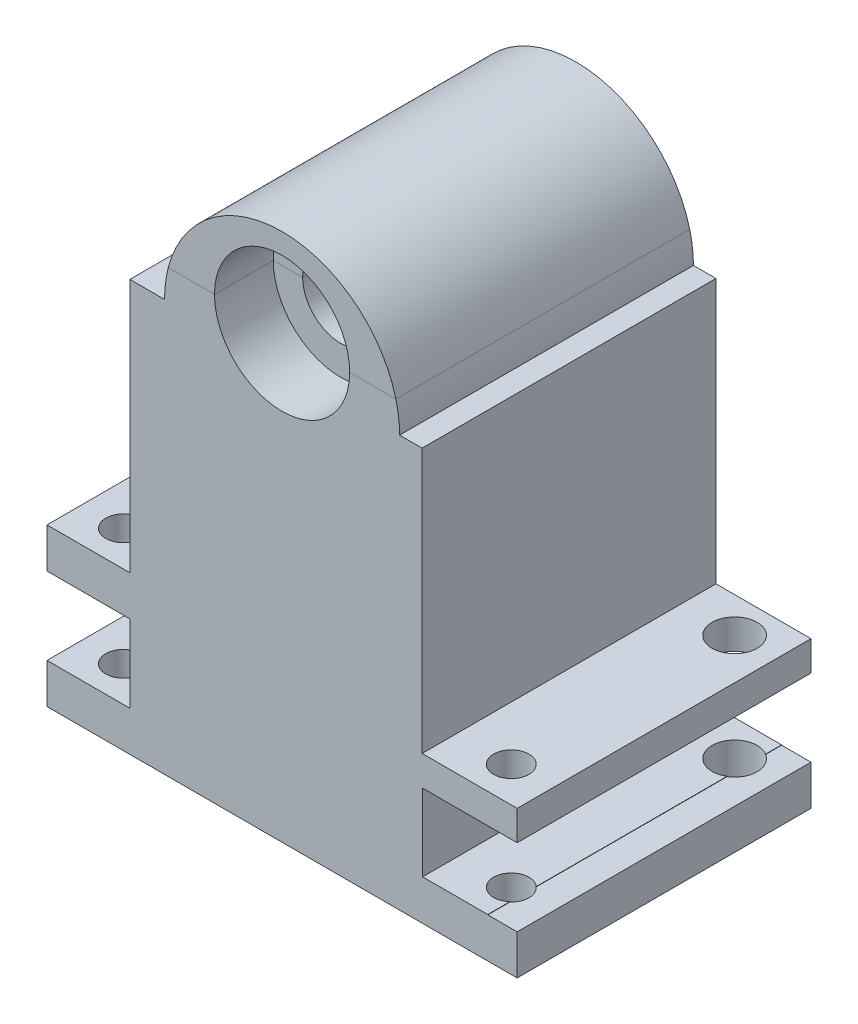
from build123d import *

# Parameters (mm, degrees)
BOSS_EXTRU_1_DEPTH      = 500
ESQUISSE2_W             = 700
ESQUISSE2_H             = 500
BOSS_EXTRU_2_DEPTH      = 250
ESQUISSE3_R             = 65
ENL_V_MAT_EXTRU_1_DEPTH = 500
ESQUISSE4_W             = 91.072749712
ESQUISSE4_H             = 131.669737078
ENL_V_MAT_EXTRU_2_DEPTH = 500
ESQUISSE5_W             = 110.887682399
ESQUISSE5_H             = 130.745719327
ENL_V_MAT_EXTRU_3_DEPTH = 500
ENL_V_START             = -100
ESQUISSE6_R             = 115
ESQUISSE6_R_2           = 65
ENL_V_MAT_EXTRU_4_DEPTH = 100
ESQUISSE7_R             = 115
ESQUISSE7_R_2           = 65
ENL_V_MAT_EXTRU_5_DEPTH = 100
ESQUISSE9_W             = 50
ESQUISSE9_H             = 500.658692186
ESQUISSE9_H_2           = 68.053564491
ESQUISSE9_H_3           = 500.318853577
ESQUISSE9_H_4           = 68.011409345
BOSS_EXTRU_3_DEPTH      = 500
ESQUISSE10_W            = 141.072749712
ESQUISSE10_H            = 432.308853577
ESQUISSE10_W_2          = 161.717775925
ESQUISSE10_H_2          = 450
ENL_V_MAT_EXTRU_6_DEPTH = 500
ESQUISSE11_R            = 30
ENL_V_MAT_EXTRU_7_DEPTH = 310
ESQUISSE12_R            = 38.334173136
ESQUISSE12_R_2          = 30
ENL_V_MAT_EXTRU_8_DEPTH = 310


with BuildPart() as part:
    # Esquisse1 → Boss.-Extru.1 (new body)
    with BuildSketch(Plane.XY):
        with BuildLine():
            Line((0, 0), (700, 0))
            Line((700, 0), (700, 450))
            Line((700, 450), (550, 450))
            ThreePointArc((550, 450), (350, 650), (150, 450))
            Line((150, 450), (0, 450))
            Line((0, 450), (0, 0))
        make_face()
    extrude(amount=BOSS_EXTRU_1_DEPTH)

    # Esquisse2 → Boss.-Extru.2 (add)
    with BuildSketch(Plane.XZ):
        with Locations((350, 250)):
            Rectangle(ESQUISSE2_W, ESQUISSE2_H)
    extrude(amount=BOSS_EXTRU_2_DEPTH)

    # Esquisse3 → Enlèv. mat.-Extru.1 (cut)
    with BuildSketch(Plane(origin=(0, 0, 0), x_dir=(-1, 0, 0), z_dir=(0, 0, -1))):
        with Locations((-350, 500)):
            Circle(ESQUISSE3_R)
    extrude(amount=-ENL_V_MAT_EXTRU_1_DEPTH, mode=Mode.SUBTRACT)

    # Esquisse4 → Enlèv. mat.-Extru.2 (cut)
    with BuildSketch(Plane(origin=(0, 0, 0), x_dir=(-1, 0, 0), z_dir=(0, 0, -1))):
        with Locations((-45.536374856, -116.153722116)):
            Rectangle(ESQUISSE4_W, ESQUISSE4_H)
    extrude(amount=-ENL_V_MAT_EXTRU_2_DEPTH, mode=Mode.SUBTRACT)

    # Esquisse5 → Enlèv. mat.-Extru.3 (cut)
    with BuildSketch(Plane(origin=(0, 0, 0), x_dir=(-1, 0, 0), z_dir=(0, 0, -1))):
        with Locations((-644.556158801, -116.03155185)):
            Rectangle(ESQUISSE5_W, ESQUISSE5_H)
    extrude(amount=-ENL_V_MAT_EXTRU_3_DEPTH, mode=Mode.SUBTRACT)

    # Esquisse6 → Enlèv. mat.-Extru.4 (cut)
    with BuildSketch(Plane.XY.offset(500).offset(ENL_V_START)):
        with Locations((350, 500)):
            Circle(ESQUISSE6_R)
        with Locations((350, 500)):
            Circle(ESQUISSE6_R_2, mode=Mode.SUBTRACT)
    extrude(amount=ENL_V_MAT_EXTRU_4_DEPTH, mode=Mode.SUBTRACT)


with BuildPart() as body_2:
    # Fractionner2: the piece on the far side of the plane
    add(part.part)
    split(bisect_by=Plane(origin=(0, 500, 0), x_dir=(0, 0, -1), z_dir=(0, -1, 0)), keep=Keep.BOTTOM)


with BuildPart() as part_1:
    add(part.part)

    # Fractionner2
    split(bisect_by=Plane(origin=(0, 500, 0), x_dir=(0, 0, -1), z_dir=(0, -1, 0)), keep=Keep.TOP)


with BuildPart() as enl_v_mat_extru_5_tool:
    # Esquisse7 → Enlèv. mat.-Extru.5 (new body)
    with BuildSketch(Plane(origin=(0, 0, 0), x_dir=(-1, 0, 0), z_dir=(0, 0, -1))):
        with Locations((-350, 500)):
            Circle(ESQUISSE7_R)
        with Locations((-350, 500)):
            Circle(ESQUISSE7_R_2, mode=Mode.SUBTRACT)
    extrude(amount=-ENL_V_MAT_EXTRU_5_DEPTH)


with BuildPart() as part_2:
    add(part_1.part)

    # Enlèv. mat.-Extru.5: cut by enl_v_mat_extru_5_tool
    add(enl_v_mat_extru_5_tool.part, mode=Mode.SUBTRACT)

    # Esquisse9 → Boss.-Extru.3 (add)
    with BuildSketch(Plane.XY.offset(500)):
        with Locations((725, 199.670653907)):
            Rectangle(ESQUISSE9_W, ESQUISSE9_H)
        with Locations((725, -215.973217755)):
            Rectangle(ESQUISSE9_W, ESQUISSE9_H_2)
        with Locations((-25, 199.840573211)):
            Rectangle(ESQUISSE9_W, ESQUISSE9_H_3)
        with Locations((-25, -215.994295328)):
            Rectangle(ESQUISSE9_W, ESQUISSE9_H_4)
    extrude(amount=-BOSS_EXTRU_3_DEPTH)

    # Esquisse10 → Enlèv. mat.-Extru.6 (cut)
    with BuildSketch(Plane.XY.offset(500)):
        with Locations((20.536374856, 233.845573212)):
            Rectangle(ESQUISSE10_W, ESQUISSE10_H)
        with Locations((669.141112038, 225)):
            Rectangle(ESQUISSE10_W_2, ESQUISSE10_H_2)
    extrude(amount=-ENL_V_MAT_EXTRU_6_DEPTH, mode=Mode.SUBTRACT)

    # Esquisse11 → Enlèv. mat.-Extru.7 (cut)
    with BuildSketch(Plane(origin=(0, 17.691146423, 0), x_dir=(1, 0, 0), z_dir=(0, 1, 0))):
        with Locations((20, -60)):
            Circle(ESQUISSE11_R)
        with Locations((20, -440)):
            Circle(ESQUISSE11_R)
    extrude(amount=-ENL_V_MAT_EXTRU_7_DEPTH, mode=Mode.SUBTRACT)

    # Esquisse12 → Enlèv. mat.-Extru.8 (cut)
    with BuildSketch(Plane(origin=(0, 0, 0), x_dir=(1, 0, 0), z_dir=(0, 1, 0))):
        with Locations((680, -60)):
            Circle(ESQUISSE12_R)
        with Locations((680, -440)):
            Circle(ESQUISSE12_R_2)
    extrude(amount=-ENL_V_MAT_EXTRU_8_DEPTH, mode=Mode.SUBTRACT)


with BuildPart() as body_2_1:
    add(body_2.part)

    # Enlèv. mat.-Extru.5: cut by enl_v_mat_extru_5_tool
    add(enl_v_mat_extru_5_tool.part, mode=Mode.SUBTRACT)


solid = Compound([part_2.part, body_2_1.part])
